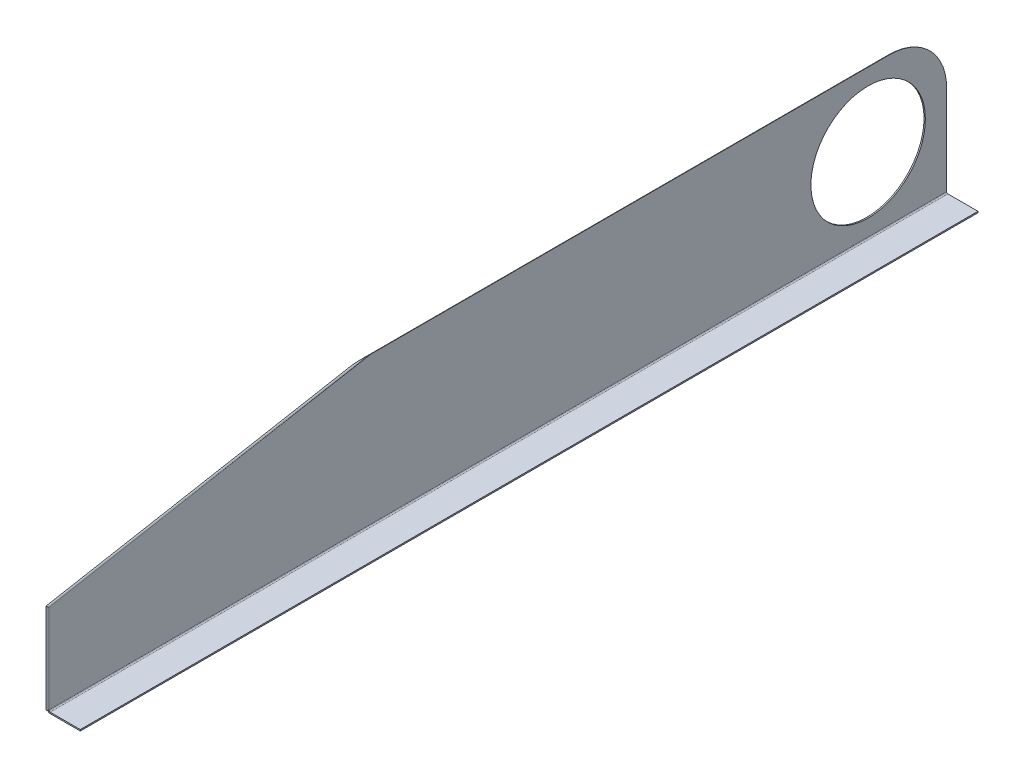
from build123d import *

# Parameters (mm, degrees)
BASE_FLANGE1_DEPTH = 0.8
SKETCH6_R          = 35.00000000000004
CUT_EXTRUDE1_DEPTH = 10
CUT_EXTRUDE2_DEPTH = 10
FILLET1_R          = 1
FILLET2_R          = 1
FILLET5_R          = 1
EDGE_FLANGE1_DEPTH = 549.0202041028867


# Sheet-metal steps are written as plain solids
with BuildPart() as part:
    # Base-Flange1: sheet metal written as solids
    # Sketch1 → Base-Flange1 (new body)
    with BuildSketch(Plane(origin=(0, 0, 0), x_dir=(0, 0, -1), z_dir=(1, 0, 0))):
        Polygon((-275.00000000000006, 10.101383653592132), (-82.96531829613122, 44.999999999999964), (274.99999999999994, 45.00000000000006), (274.99999999999994, -44.99999999999994), (-275.00000000000006, -45), align=None)
    extrude(amount=-BASE_FLANGE1_DEPTH)

    # Sketch6 → Cut-Extrude1 (cut)
    with BuildSketch(Plane(origin=(0, 0, 0), x_dir=(0, 0, -1), z_dir=(1, 0, 0))):
        with Locations((226.99999999999997, 0)):
            Circle(SKETCH6_R)
    extrude(amount=-CUT_EXTRUDE1_DEPTH, mode=Mode.SUBTRACT)

    # Sketch7 → Cut-Extrude2 (cut)
    with BuildSketch(Plane(origin=(0, 0, 0), x_dir=(0, 0, -1), z_dir=(1, 0, 0))):
        with BuildLine():
            Line((274.99999999999994, 45.00000000000006), (239.99999999999997, 45.00000000000006))
            ThreePointArc((239.99999999999997, 45.00000000000006), (264.74873734152914, 34.74873734152919), (274.99999999999994, 10.00000000000005))
            Line((274.99999999999994, 10.00000000000005), (274.99999999999994, 45.00000000000006))
        make_face()
    extrude(amount=-CUT_EXTRUDE2_DEPTH, mode=Mode.SUBTRACT)

    # Fillet1
    # the kernel refuses this fillet: 1 mm, written as the material it takes off along each edge
    with BuildSketch(Plane(origin=(0, 9.663409461677158, 277.4100163084993), x_dir=(-1.0, -1.5331256382814002e-12, -2.7861614884612947e-13), z_dir=(0, 0.1788022151163431, -0.9838850379335429))) as fillet1_piece_1:
        with BuildLine():
            CenterArc((1.0000000000015268, -0.979795897113006), FILLET1_R, 101.53695903288988, 78.46304096719939)
            Line((1.52675e-12, -0.9797958971145642), (-0.01999999999847325, -0.9797958971145954))
            Line((-0.01999999999847325, -0.9797958971145954), (-0.02, -3.816e-14))
            Line((-0.02, -3.816e-14), (-3.116e-14, 0.01999999999999651))
            ThreePointArc((-3.116e-14, 0.01999999999999651), (0.4000000000000967, 0.0200000000006233), (0.7960000000002303, 0.01959591794225489))
            Line((0.7960000000002303, 0.01959591794225489), (0.8000000000002557, 0))
        make_face()
    extrude(amount=204.97795897114563, mode=Mode.SUBTRACT)

    # Fillet2
    # the kernel refuses this fillet: 1 mm, written as the material it takes off along each edge
    with BuildSketch(Plane(origin=(-0.8, 10.00000000000005, -274.99999999999994), x_dir=(0, 0, 1), z_dir=(0, -1, 0))) as fillet2_piece_1:
        with BuildLine():
            CenterArc((0.9797958971145704, -1), FILLET2_R, 90, 78.46304096719936)
            Line((1.25056e-12, -0.8000000000002546), (-0.01959591794098969, -0.7960000000002597))
            ThreePointArc((-0.01959591794098969, -0.7960000000002597), (-0.01999999999998181, -0.4000000000001273), (-0.01999999999998181, 0))
            Line((-0.01999999999998181, 0), (0, 0.02000000000000002))
            Line((0, 0.02000000000000002), (0.9797958971145704, 0.02000000000000002))
            Line((0.9797958971145704, 0.02000000000000002), (0.9797958971145704, 0))
        make_face()
    extrude(amount=57.44948974278642, mode=Mode.SUBTRACT)
    with BuildSketch(Plane(origin=(-0.8, 10.000000000000078, -239.99999999999997), x_dir=(0, -1.07e-15, -1), z_dir=(0, -1, 1.07e-15))) as fillet2_piece_2:
        with BuildLine():
            CenterArc((34.0202041028854, 1), FILLET2_R, 270, 78.46304096719928)
            Line((34.99999999999872, 0.800000000000253), (35.01959591794102, 0.7960000000002581))
            ThreePointArc((35.01959591794102, 0.7960000000002581), (35.01999999999995, 0.4000000000001265), (35.01999999999995, 0))
            Line((35.01999999999995, 0), (34.999999999999915, -0.02000000000000002))
            Line((34.999999999999915, -0.02000000000000002), (34.0202041028854, -0.02000000000000002))
            Line((34.0202041028854, -0.02000000000000002), (34.0202041028854, 0))
        make_face()
    revolve(axis=Axis((-0.8, 10.000000000000078, -239.99999999999997), (1, 0, 0)), revolution_arc=90.00000000000006, mode=Mode.SUBTRACT)
    with BuildSketch(Plane(origin=(-0.8, 44.999999999999964, 90.3137875244906), x_dir=(0, -1, -2.6e-16), z_dir=(0, 2.6e-16, -1))) as fillet2_piece_3:
        with BuildLine():
            CenterArc((0.9797958971145846, -1), FILLET2_R, 90, 78.46304096719959)
            Line((1.25766e-12, -0.8000000000002574), (-0.01959591794101101, -0.7960000000002625))
            ThreePointArc((-0.01959591794101101, -0.7960000000002625), (-0.02000000000000313, -0.4000000000001287), (-0.02000000000000313, 0))
            Line((-0.02000000000000313, 0), (0, 0.02000000000000002))
            Line((0, 0.02000000000000002), (0.9797958971145846, 0.02000000000000002))
            Line((0.9797958971145846, 0.02000000000000002), (0.9797958971145846, 0))
        make_face()
    extrude(amount=330.3137875244905, mode=Mode.SUBTRACT)

    # Fillet5
    # the kernel refuses this fillet: 1 mm, written as the material it takes off along each edge
    with BuildSketch(Plane(origin=(0, -47.449489742786426, 275.00000000000006), x_dir=(-1.0, 0, -1.5631940186717228e-12), z_dir=(0, 1, 0))) as fillet5_piece_1:
        with BuildLine():
            CenterArc((1.0000000000015317, -0.9797958971130072), FILLET5_R, 101.53695903289021, 78.46304096719933)
            Line((1.53161e-12, -0.9797958971145704), (0, 0))
            Line((0, 0), (0.8000000000002546, 0))
        make_face()
    extrude(amount=59.00451925564195, mode=Mode.SUBTRACT)

    # Edge-Flange1: sheet metal written as solids
    # Edge-Flange1 section (on a plane across the edge) → Edge-Flange1 (add)
    with BuildSketch(Plane(origin=(-5.59e-15, -45.800000000000004, 274.0202041028868), x_dir=(3.49e-15, 1, 1e-16), z_dir=(0, 1e-16, -1))):
        with BuildLine():
            Line((-0.8, 0.8000000000000028), (-0.8, 19.200000000000003))
            Line((-0.8, 19.200000000000003), (0, 19.200000000000003))
            Line((0, 19.200000000000003), (0, 0.8000000000000028))
            ThreePointArc((0, 0.8000000000000028), (0.23431457505076303, 0.2343145750507638), (0.8000000000000028, 2.78e-15))
            Line((0.8000000000000028, 2.78e-15), (0.8000000000000056, -0.7999999999999973))
            ThreePointArc((0.8000000000000056, -0.7999999999999973), (-0.331370849898474, -0.3313708498984752), (-0.8, 0.8000000000000028))
        make_face()
    extrude(amount=EDGE_FLANGE1_DEPTH)


solid = part.part
